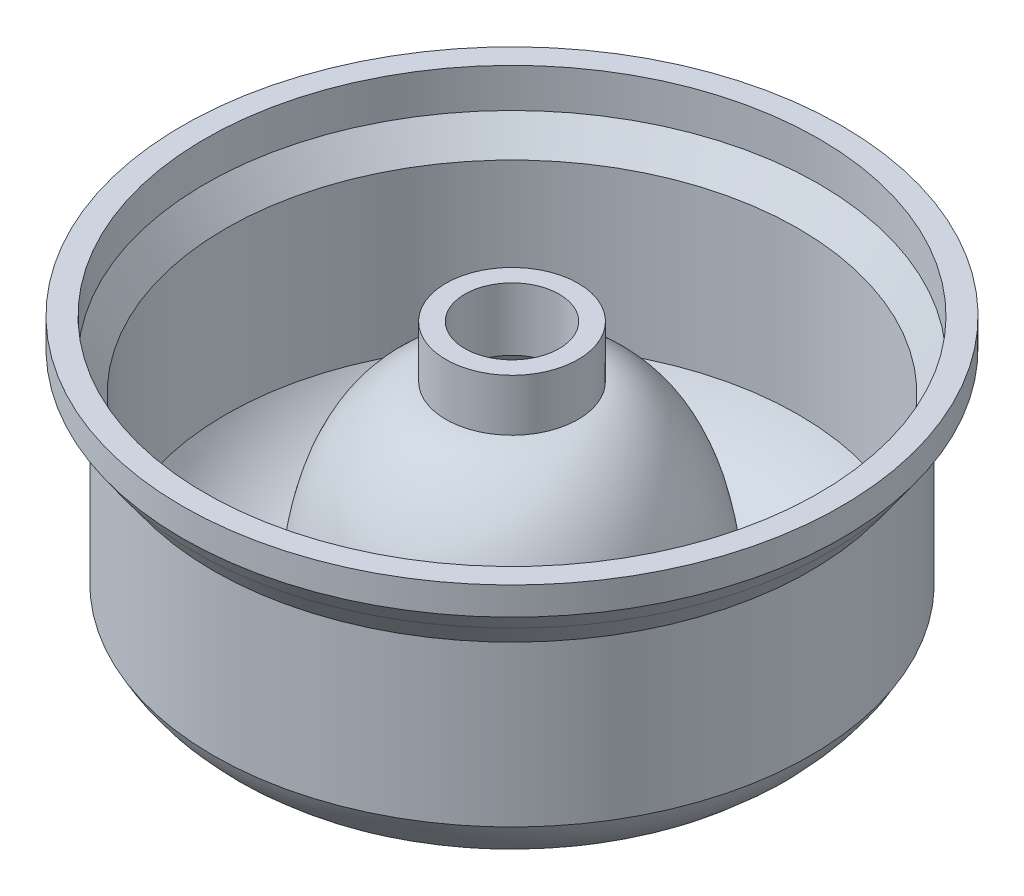
from build123d import *

# Parameters (mm, degrees)
SCALE1_OUTLINE_W     = 7.500000391
SCALE1_OUTLINE_H     = 22.805226105
SCALE1_OUTLINE_W_2   = 13.088589984
SCALE1_OUTLINE_H_2   = 16.734119041
SCALE1_2_OUTLINE_W   = 1.95
SCALE1_2_OUTLINE_H   = 8.24999891
SCALE1_2_OUTLINE_H_2 = 1.711244051
SCALE1_2_OUTLINE_W_2 = 1.049999765
SCALE1_2_OUTLINE_H_3 = 0.134559544
SCALE1_2_OUTLINE_W_3 = 3.6
SCALE1_2_OUTLINE_H_4 = 0.749999983
SCALE1_START         = -7.737842468
SCALE1_3_OUTLINE_R   = 34.905620152
SCALE1_3_OUTLINE_R_2 = 25.53859014
SCALE1_3_OUTLINE_R_3 = 7.000000104
SCALE1_3_OUTLINE_R_4 = 5.000000261
SCALE1_3_DEPTH       = 30.737841954
SCALE1_START_2       = -0.474222564
SCALE1_4_OUTLINE_R   = 10.500000156
SCALE1_4_OUTLINE_R_2 = 7.500000391
SCALE1_4_DEPTH       = 18.570926774
SCALE1_START_3       = -0.608782108
SCALE1_5_OUTLINE_R   = 17.02572676
SCALE1_5_OUTLINE_R_2 = 15.72572676
SCALE1_5_DEPTH       = 0.134559544


with BuildPart() as part:
    # Sketch1 → Revolve1 (revolve)
    with BuildSketch(Plane.XY, mode=Mode.PRIVATE) as revolve1_sk:
        with BuildLine():
            Line((-7.000000104, 22.499999497), (-7.000000104, 17.000000224))
            add(Edge.make_bspline(
                [(-7.000000104, 17.000000224), (-8.536141304, 16.79879583), (-14.28254756, 13.442155902), (-16.389021035, 6.428633935), (-17.02572676, 1.796516154)],
                knots=[0, 0, 0, 0, 0.237277577, 1, 1, 1, 1], degree=3))
            Line((-17.02572676, 1.796516154), (-17.02572676, -7.604329067))
            ThreePointArc((-17.02572676, -7.604329067), (-17.300179846, -7.947424503), (-17.707856522, -8.111249723))
            ThreePointArc((-17.707856522, -8.111249723), (-25.040740609, -6.529098104), (-30.323752969, -1.203295518))
            Line((-30.323752969, -1.203295518), (-30.323752969, 15.858416222))
            Line((-30.323752969, 15.858416222), (-32.505620152, 18.860921314))
            Line((-32.505620152, 18.860921314), (-32.505620152, 20.047308357))
            Line((-32.505620152, 20.047308357), (-32.505620152, 22.999999486))
            Line((-32.505620152, 22.999999486), (-34.905620152, 22.999999486))
            Line((-34.905620152, 22.999999486), (-34.905620152, 20.047308357))
            Line((-34.905620152, 20.047308357), (-33.557272362, 18.09670431))
            add(Edge.make_bspline(
                [(-33.557272362, 18.09670431), (-32.912765898, 17.20978784), (-32.268259433, 16.32287137), (-31.623752969, 15.435954899)],
                knots=[0, 0, 0, 0, 0.886176486, 0.886176486, 0.886176486, 0.886176486], degree=3))
            Line((-31.623752969, 15.435954899), (-31.623752969, -1.522179518))
            ThreePointArc((-31.623752969, -1.522179518), (-25.800120471, -7.594480577), (-17.583821153, -9.405546874))
            ThreePointArc((-17.583821153, -9.405546874), (-16.40877561, -8.898313798), (-15.72572676, -7.81597296))
            Line((-15.72572676, -7.81597296), (-15.72572676, 1.706809791))
            add(Edge.make_bspline(
                [(-15.72572676, 1.706809791), (-15.615023415, 2.498060507), (-15.346330749, 4.056440245), (-14.737946403, 6.46171077), (-13.905433252, 8.779762536), (-12.821118751, 10.938632312), (-11.473087245, 12.841681257), (-10.094538345, 14.178825349), (-8.874086433, 15.012741309), (-8.081589266, 15.392455243), (-7.440851602, 15.598591787), (-7.062763612, 15.678727138), (-6.82748859, 15.711717395), (-6.600646999, 15.741074943), (-6.236482767, 15.788998756), (-5.91309335, 15.831259817), (-5.700000104, 15.859170856)],
                knots=[-0.058241325, -0.058241325, -0.058241325, -0.058241325, 0.073419095, 0.205079515, 0.336739936, 0.468400356, 0.600060776, 0.731721196, 0.797551406, 0.863381616, 0.896296721, 0.929211826, 0.937440602, 0.945669378, 0.962126931, 0.995042036, 0.995042036, 0.995042036, 0.995042036], degree=3))
            Line((-5.700000104, 15.859170856), (-5.000000261, 15.859170856))
            Line((-5.000000261, 15.859170856), (-5.000000261, 22.499999497))
            Line((-5.000000261, 22.499999497), (-7.000000104, 22.499999497))
        make_face()
    revolve(revolve1_sk.sketch.rotate(Axis((0, 0, 0), (0, 1, 0)), 270), axis=Axis((0, 0, 0), (0, 1, 0)))

    # Scale1: read off the stored shape, not the designer's step
    # Scale1 outline → Scale1 (revolve, cut)
    with BuildSketch(Plane.XY.offset(6.4582e-05)):
        with BuildLine():
            add(Edge.make_bspline(
                [(23.569600439, -0.474222564), (23.407221925, 0.666506856), (23.007993943, 2.961137879), (22.106919604, 6.52356936), (20.858149879, 10.000647009), (19.231678126, 13.238951674), (17.209630867, 16.09352509), (15.141807518, 18.099241229), (13.311129649, 19.350115169), (12.122383899, 19.919686069), (11.188458251, 20.22014633), (10.714112032, 20.323498357), (10.500000156, 20.359610991)],
                knots=[-0.053262952, -0.053262952, -0.053262952, -0.053262952, 0.073419095, 0.205079515, 0.336739936, 0.468400356, 0.600060776, 0.731721196, 0.797551406, 0.863381616, 0.896296721, 0.925488366, 0.925488366, 0.925488366, 0.925488366], degree=3))
            Line((10.500000156, 20.359610991), (10.500000156, -0.474222564))
            Line((10.500000156, -0.474222564), (23.569600439, -0.474222564))
        make_face()
        with Locations((3.750000196, 10.928390488)):
            Rectangle(SCALE1_OUTLINE_W, SCALE1_OUTLINE_H)
        with Locations((17.044295148, -8.975841628)):
            Rectangle(SCALE1_OUTLINE_W_2, SCALE1_OUTLINE_H_2)
    revolve(axis=Axis((0, 0, 6.4582e-05), (0, 1, 0)), mode=Mode.SUBTRACT)

    # Scale1 2 outline → Scale1 2 (revolve)
    with BuildSketch(Plane.XY.offset(6.4582e-05)):
        with Locations((9.525000156, 26.456002996)):
            Rectangle(SCALE1_2_OUTLINE_W, SCALE1_2_OUTLINE_H)
        with BuildLine():
            add(Edge.make_bspline(
                [(10.500000156, 22.331003541), (12.091785865, 22.122510807), (13.55998342, 21.48791389), (14.88862859, 20.61975949)],
                knots=[0, 0, 0, 0, 0.163915077, 0.163915077, 0.163915077, 0.163915077], degree=3))
            Line((10.500000156, 22.331003541), (10.500000156, 20.61975949))
            Line((10.500000156, 20.61975949), (14.88862859, 20.61975949))
        make_face()
        with Locations((9.525000156, 21.475381516)):
            Rectangle(SCALE1_2_OUTLINE_W, SCALE1_2_OUTLINE_H_2)
        with BuildLine():
            add(Edge.make_bspline(
                [(14.88862859, 20.61975949), (15.483282431, 20.231204772), (19.588815041, 17.077328651), (22.152057592, 12.373980836), (23.58859014, 8.093228858)],
                knots=[0.163915077, 0.163915077, 0.163915077, 0.163915077, 0.237277577, 0.695399718, 0.695399718, 0.695399718, 0.695399718], degree=3))
            Line((14.88862859, 20.61975949), (10.500000156, 20.61975949))
            Line((10.500000156, 20.61975949), (10.500000156, 20.359610991))
            add(Edge.make_bspline(
                [(23.569600439, -0.474222564), (23.407221925, 0.666506856), (23.007993943, 2.961137879), (22.106919604, 6.52356936), (20.858149879, 10.000647009), (19.231678126, 13.238951674), (17.209630867, 16.09352509), (15.141807518, 18.099241229), (13.311129649, 19.350115169), (12.122383899, 19.919686069), (11.188458251, 20.22014633), (10.714112032, 20.323498357), (10.500000156, 20.359610991)],
                knots=[-0.053262952, -0.053262952, -0.053262952, -0.053262952, 0.073419095, 0.205079515, 0.336739936, 0.468400356, 0.600060776, 0.731721196, 0.797551406, 0.863381616, 0.896296721, 0.925488366, 0.925488366, 0.925488366, 0.925488366], degree=3))
            Line((23.569600439, -0.474222564), (23.58859014, -0.474222564))
            Line((23.58859014, -0.474222564), (23.58859014, 8.093228858))
        make_face()
        with BuildLine():
            Line((10.500000156, 20.359610991), (10.500000156, 20.61975949))
            Line((10.500000156, 20.61975949), (8.550000156, 20.61975949))
            add(Edge.make_bspline(
                [(10.500000156, 20.359610991), (10.472689703, 20.364217239), (10.385485446, 20.378352208), (10.241232886, 20.398579298), (9.900970499, 20.44261562), (9.35472415, 20.514501339), (8.869640025, 20.577892931), (8.550000156, 20.61975949)],
                knots=[0.925488366, 0.925488366, 0.925488366, 0.925488366, 0.929211826, 0.937440602, 0.945669378, 0.962126931, 0.995042036, 0.995042036, 0.995042036, 0.995042036], degree=3))
        make_face()
        with Locations((8.025000274, 21.475381516)):
            Rectangle(SCALE1_2_OUTLINE_W_2, SCALE1_2_OUTLINE_H_2)
        with Locations((8.025000274, 26.456002996)):
            Rectangle(SCALE1_2_OUTLINE_W_2, SCALE1_2_OUTLINE_H)
        with BuildLine():
            add(Edge.make_bspline(
                [(23.58859014, 8.093228858), (24.543724546, 5.247004801), (25.157178625, 2.300596307), (25.53859014, -0.474222564)],
                knots=[0.695399718, 0.695399718, 0.695399718, 0.695399718, 1, 1, 1, 1], degree=3))
            Line((23.58859014, 8.093228858), (23.58859014, -0.474222564))
            Line((23.58859014, -0.474222564), (25.53859014, -0.474222564))
        make_face()
        with Locations((24.56359014, -0.541502336)):
            Rectangle(SCALE1_2_OUTLINE_W, SCALE1_2_OUTLINE_H_3)
        with BuildLine():
            Line((23.58859014, -0.608782108), (23.58859014, -0.474222564))
            Line((23.58859014, -0.474222564), (23.569600439, -0.474222564))
            add(Edge.make_bspline(
                [(23.58859014, -0.608782108), (23.582311232, -0.563903691), (23.575981617, -0.519051141), (23.569600439, -0.474222564)],
                knots=[-0.058241325, -0.058241325, -0.058241325, -0.058241325, -0.053262952, -0.053262952, -0.053262952, -0.053262952], degree=3))
        make_face()
        with BuildLine():
            Line((25.53859014, -14.575490395), (25.53859014, -0.608782108))
            Line((25.53859014, -0.608782108), (23.58859014, -0.608782108))
            Line((23.58859014, -0.608782108), (23.58859014, -14.892956235))
            ThreePointArc((23.58859014, -14.892956235), (24.304354673, -16.214472206), (25.53859014, -17.072018788))
            Line((25.53859014, -17.072018788), (25.53859014, -14.575490395))
        make_face()
        with Locations((46.460629454, -0.541502336)):
            Rectangle(SCALE1_2_OUTLINE_W, SCALE1_2_OUTLINE_H_3)
        Polygon((45.485629454, 20.618627539), (45.485629454, -0.474222564), (47.435629454, -0.474222564), (47.435629454, 19.984935554), (47.435629454, 20.61975949), (45.486452023, 20.61975949), align=None)
        Polygon((47.435629454, 22.331003541), (46.729982715, 22.331003541), (45.486452023, 20.61975949), (47.435629454, 20.61975949), align=None)
        Polygon((47.435629454, 23.302056199), (46.729982715, 22.331003541), (47.435629454, 22.331003541), align=None)
        with BuildLine():
            ThreePointArc((26.561784783, -15.335871378), (25.950269769, -15.09013355), (25.53859014, -14.575490395))
            Line((25.53859014, -14.575490395), (25.53859014, -17.072018788))
            ThreePointArc((25.53859014, -17.072018788), (25.950317126, -17.202574831), (26.375731729, -17.277317106))
            ThreePointArc((26.375731729, -17.277317106), (27.218541222, -17.326498868), (28.062625137, -17.342901049))
            ThreePointArc((28.062625137, -17.342901049), (37.810118465, -15.033672446), (45.485629454, -8.596849163))
            Line((45.485629454, -8.596849163), (45.485629454, -4.973940071))
            ThreePointArc((45.485629454, -4.973940071), (37.561110914, -12.96264395), (26.561784783, -15.335871378))
        make_face()
        with BuildLine():
            Line((47.435629454, -0.608782108), (45.485629454, -0.608782108))
            Line((45.485629454, -0.608782108), (45.485629454, -4.973940071))
            Line((45.485629454, -4.973940071), (45.485629454, -8.596849163))
            ThreePointArc((45.485629454, -8.596849163), (46.527691169, -7.066143526), (47.435629454, -5.452266072))
            Line((47.435629454, -5.452266072), (47.435629454, -0.608782108))
        make_face()
        Polygon((48.758430228, 25.122385177), (47.435629454, 23.302056199), (47.435629454, 22.331003541), (48.758430228, 22.331003541), align=None)
        Polygon((48.758430228, 22.331003541), (47.435629454, 22.331003541), (47.435629454, 20.61975949), (47.896944746, 20.61975949), (48.758430228, 21.805264532), align=None)
        Polygon((47.435629454, 20.61975949), (47.435629454, 19.984935554), (47.896944746, 20.61975949), align=None)
        Polygon((52.358430228, 30.581002451), (48.758430228, 30.581002451), (48.758430228, 25.122385177), (48.758430228, 22.331003541), (49.140475438, 22.331003541), (50.335908543, 23.976059671), (52.358430228, 26.901965741), align=None)
        with Locations((50.558430228, 30.956002443)):
            Rectangle(SCALE1_2_OUTLINE_W_3, SCALE1_2_OUTLINE_H_4)
        Polygon((49.140475438, 22.331003541), (48.758430228, 22.331003541), (48.758430228, 21.805264532), align=None)
    revolve(axis=Axis((0, 0, 6.4582e-05), (0, 1, 0)))

    # Scale1 3 outline → Scale1 3 (cut)
    # profile 1 of 2: a face of its own
    with BuildSketch(Plane(origin=(0, 0, 0), x_dir=(1, 0, 0), z_dir=(0, 1, 0)).offset(SCALE1_START)):
        Circle(SCALE1_3_OUTLINE_R)
        with Locations((0, -6.4582e-05)):
            Circle(SCALE1_3_OUTLINE_R_2, mode=Mode.SUBTRACT)
    # profile 2 of 2: a face of its own
    with BuildSketch(Plane(origin=(0, 0, 0), x_dir=(1, 0, 0), z_dir=(0, 1, 0)).offset(SCALE1_START)):
        Circle(SCALE1_3_OUTLINE_R_3)
        Circle(SCALE1_3_OUTLINE_R_4, mode=Mode.SUBTRACT)
    extrude(amount=SCALE1_3_DEPTH, mode=Mode.SUBTRACT)

    # Scale1 4 outline → Scale1 4 (cut)
    with BuildSketch(Plane(origin=(0, 0, 0), x_dir=(1, 0, 0), z_dir=(0, 1, 0)).offset(SCALE1_START_2)):
        with Locations((0, -6.4582e-05)):
            Circle(SCALE1_4_OUTLINE_R)
        with Locations((0, -6.4582e-05)):
            Circle(SCALE1_4_OUTLINE_R_2, mode=Mode.SUBTRACT)
    extrude(amount=SCALE1_4_DEPTH, mode=Mode.SUBTRACT)

    # Scale1 5 outline → Scale1 5 (cut)
    with BuildSketch(Plane(origin=(0, 0, 0), x_dir=(1, 0, 0), z_dir=(0, 1, 0)).offset(SCALE1_START_3)):
        Circle(SCALE1_5_OUTLINE_R)
        Circle(SCALE1_5_OUTLINE_R_2, mode=Mode.SUBTRACT)
    extrude(amount=SCALE1_5_DEPTH, mode=Mode.SUBTRACT)


solid = part.part
